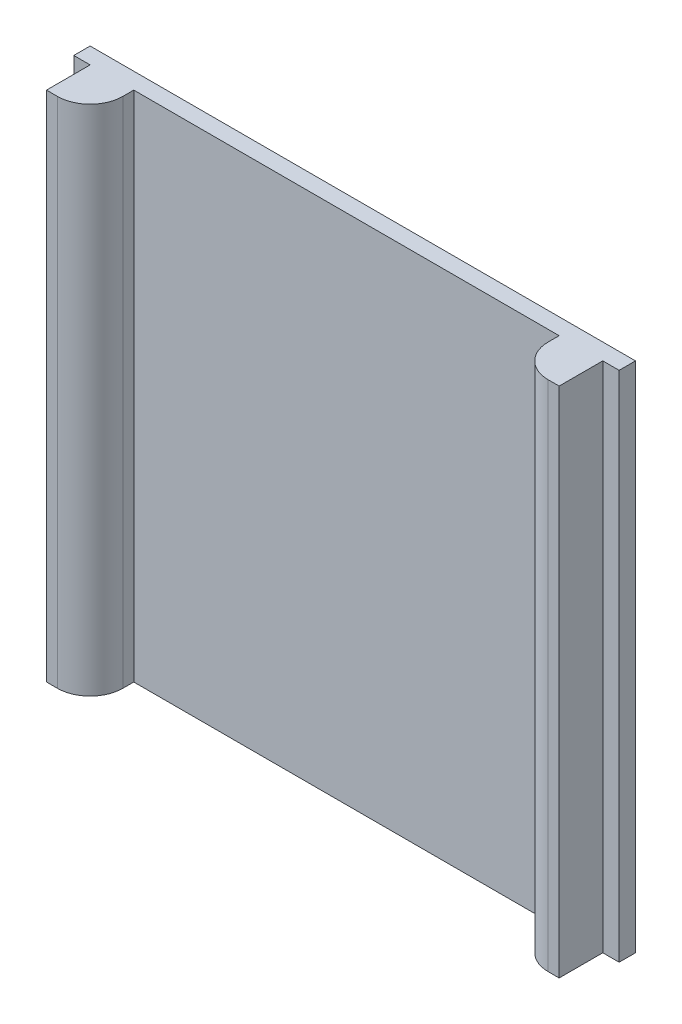
from build123d import *

# Parameters (mm, degrees)
SCHIZZO1_W                   = 500
SCHIZZO1_H                   = 470
ESTRUSIONE_ESTRUSIONE1_DEPTH = 15
SCHIZZO2_W                   = 40
SCHIZZO2_H                   = 470
ESTRUSIONE_ESTRUSIONE2_DEPTH = 40
RACCORDO1_R                  = 30
RACCORDO1_OF_SPECCHIA1_R     = 30


with BuildPart() as part:
    # Schizzo1 → Estrusione-Estrusione1 (new body)
    with BuildSketch(Plane.XY):
        Rectangle(SCHIZZO1_W, SCHIZZO1_H)
    extrude(amount=ESTRUSIONE_ESTRUSIONE1_DEPTH)

    # Schizzo2 → Estrusione-Estrusione2 (add)
    with BuildSketch(Plane.XY.offset(15)):
        with Locations((-215, 0)):
            Rectangle(SCHIZZO2_W, SCHIZZO2_H)
    estrusione_estrusione2 = extrude(amount=ESTRUSIONE_ESTRUSIONE2_DEPTH)

    # Raccordo1
    raccordo1_edges = [part.edges().sort_by_distance(p)[0] for p in [
        (-195, 0, 55),
    ]]
    fillet(raccordo1_edges, radius=RACCORDO1_R)

    # Specchia1: Estrusione-Estrusione2 across plane
    add(estrusione_estrusione2.mirror(Plane(origin=(0, 0, 0), x_dir=(0, 0, 1), z_dir=(1, 0, 0))))

    # Raccordo1 of Specchia1
    raccordo1_of_specchia1_edges = [part.edges().sort_by_distance(p)[0] for p in [
        (195, 0, 55),
    ]]
    fillet(raccordo1_of_specchia1_edges, radius=RACCORDO1_OF_SPECCHIA1_R)


solid = part.part
